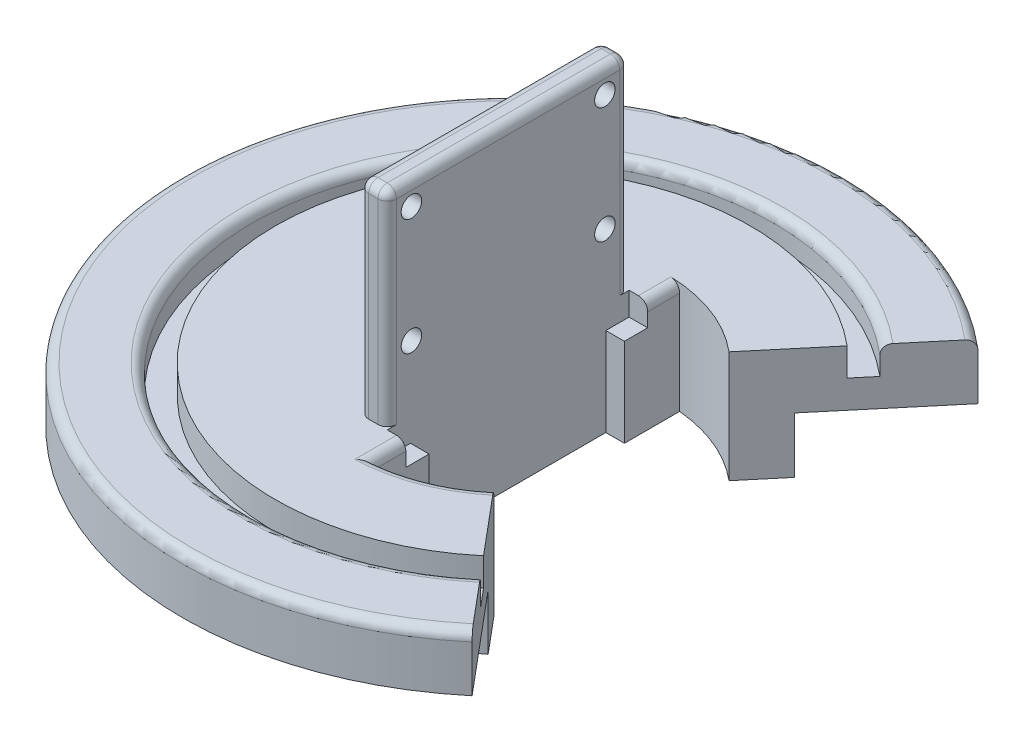
from build123d import *

# Parameters (mm, degrees)
RESSALTO_EXTRUS_O1_DEPTH = 12
RESSALTO_EXTRUS_O3_DEPTH = 6
ESBO_O4_W                = 3
ESBO_O4_H                = 26
RESSALTO_EXTRUS_O4_DEPTH = 22
ESBO_O6_W                = 2.5
ESBO_O6_H                = 9.5
RESSALTO_EXTRUS_O5_DEPTH = 2
ESBO_O7_R                = 1.1
CORTE_EXTRUS_O1_DEPTH    = 55.490824916
ESBO_O8_R                = 28.014084507
ESBO_O8_R_2              = 25.514084507
CORTE_EXTRUS_O2_DEPTH    = 3
FILETE1_R                = 1


with BuildPart() as part:
    # Esboço1 → Ressalto-extrusão1 (new body)
    with BuildSketch(Plane(origin=(0, 0, 0), x_dir=(1, 0, 0), z_dir=(0, 1, 0))):
        with BuildLine():
            Line((1.5, -16.431676725), (1.5, -13))
            Line((1.5, -13), (-0.5, -13))
            Line((-0.5, -13), (-0.5, 13))
            Line((-0.5, 13), (1.5, 13))
            Line((1.5, 13), (1.5, 16.431676725))
            ThreePointArc((1.5, 16.431676725), (6.342987532, 15.232088142), (10.60599556, 12.639733311))
            Line((10.60599556, 12.639733311), (13.819933608, 16.469955527))
            ThreePointArc((13.819933608, 16.469955527), (-21.5, 0), (13.819933608, -16.469955527))
            Line((13.819933608, -16.469955527), (10.60599556, -12.639733311))
            ThreePointArc((10.60599556, -12.639733311), (6.342987532, -15.232088142), (1.5, -16.431676725))
        make_face()
    extrude(amount=-RESSALTO_EXTRUS_O1_DEPTH)

    # Esboço3 → Ressalto-extrusão3 (add)
    with BuildSketch(Plane(origin=(0, 0, 0), x_dir=(1, 0, 0), z_dir=(0, 1, 0))):
        with BuildLine():
            Line((13.819933608, -16.469955527), (22.818960144, -27.194577731))
            ThreePointArc((22.818960144, -27.194577731), (-35.5, 0), (22.818960144, 27.194577731))
            Line((22.818960144, 27.194577731), (13.819933608, 16.469955527))
            ThreePointArc((13.819933608, 16.469955527), (-21.5, 0), (13.819933608, -16.469955527))
        make_face()
    extrude(amount=-RESSALTO_EXTRUS_O3_DEPTH)

    # Esboço4 → Ressalto-extrusão4 (add)
    with BuildSketch(Plane(origin=(0, 0, 0), x_dir=(1, 0, 0), z_dir=(0, 1, 0))):
        with Locations((-2, 0)):
            Rectangle(ESBO_O4_W, ESBO_O4_H)
    extrude(amount=RESSALTO_EXTRUS_O4_DEPTH)

    # Esboço6 → Ressalto-extrusão5 (add)
    with BuildSketch(Plane(origin=(-0.5, 0, 0), x_dir=(0, 0, -1), z_dir=(1, 0, 0))):
        with Locations((-11.75, -7.25)):
            Rectangle(ESBO_O6_W, ESBO_O6_H)
        with Locations((11.75, -7.25)):
            Rectangle(ESBO_O6_W, ESBO_O6_H)
    extrude(amount=RESSALTO_EXTRUS_O5_DEPTH)

    # Esboço7 → Corte-extrusão1 (cut, through all)
    with BuildSketch(Plane(origin=(-0.5, 0, 0), x_dir=(0, 0, -1), z_dir=(1, 0, 0))):
        with Locations((-10.4, 19.5)):
            Circle(ESBO_O7_R)
        with Locations((10.4, 19.5)):
            Circle(ESBO_O7_R)
        with Locations((10.4, 7)):
            Circle(ESBO_O7_R)
        with Locations((-10.4, 7)):
            Circle(ESBO_O7_R)
    extrude(amount=-CORTE_EXTRUS_O1_DEPTH, mode=Mode.SUBTRACT)

    # Esboço8 → Corte-extrusão2 (cut)
    with BuildSketch(Plane(origin=(0, 0, 0), x_dir=(1, 0, 0), z_dir=(0, 1, 0))):
        Circle(ESBO_O8_R)
        Circle(ESBO_O8_R_2, mode=Mode.SUBTRACT)
    extrude(amount=-CORTE_EXTRUS_O2_DEPTH, mode=Mode.SUBTRACT)

    # Filete1
    # the kernel refuses this fillet: 1 mm, written as the material it takes off along each edge
    with BuildSketch(Plane(origin=(-2.5, 21, 12), x_dir=(0, 0, 1), z_dir=(-1, 0, 0))) as filete1_piece_1_section:
        Polygon((0, 0), (FILETE1_R * 1.02, 0), (FILETE1_R * 1.02, FILETE1_R * 1.02), (0, FILETE1_R * 1.02), align=None)
    filete1_piece_1 = extrude(amount=FILETE1_R * 1.02, mode=Mode.PRIVATE)
    filete1_piece_1 = filete1_piece_1 - Plane(origin=(-2.5, 21, 12), x_dir=(0, -0.7071067811865475, -0.7071067811865475), z_dir=(-1, 0, 0)) * Sphere(FILETE1_R, mode=Mode.PRIVATE)
    add(filete1_piece_1, mode=Mode.SUBTRACT)
    with BuildSketch(Plane(origin=(-1.5, 21, 12), x_dir=(0, 0, 1), z_dir=(0, 1, 0))) as filete1_piece_2_section:
        Polygon((0, 0), (FILETE1_R * 1.02, 0), (FILETE1_R * 1.02, FILETE1_R * 1.02), (0, FILETE1_R * 1.02), align=None)
    filete1_piece_2 = extrude(amount=FILETE1_R * 1.02, mode=Mode.PRIVATE)
    filete1_piece_2 = filete1_piece_2 - Plane(origin=(-1.5, 21, 12), x_dir=(-0.7071067811865476, 0, -0.7071067811865475), z_dir=(0, 1, 0)) * Sphere(FILETE1_R, mode=Mode.PRIVATE)
    add(filete1_piece_2, mode=Mode.SUBTRACT)
    with BuildSketch(Plane(origin=(-1.5, 21, -12), x_dir=(1, 0, 0), z_dir=(0, 1, 0))) as filete1_piece_3_section:
        Polygon((0, 0), (FILETE1_R * 1.02, 0), (FILETE1_R * 1.02, FILETE1_R * 1.02), (0, FILETE1_R * 1.02), align=None)
    filete1_piece_3 = extrude(amount=FILETE1_R * 1.02, mode=Mode.PRIVATE)
    filete1_piece_3 = filete1_piece_3 - Plane(origin=(-1.5, 21, -12), x_dir=(-0.7071067811865475, 0, 0.7071067811865477), z_dir=(0, 1, 0)) * Sphere(FILETE1_R, mode=Mode.PRIVATE)
    add(filete1_piece_3, mode=Mode.SUBTRACT)
    with BuildSketch(Plane(origin=(-2.5, 21, -12), x_dir=(0, 1, 0), z_dir=(-1, 0, 0))) as filete1_piece_4_section:
        Polygon((0, 0), (FILETE1_R * 1.02, 0), (FILETE1_R * 1.02, FILETE1_R * 1.02), (0, FILETE1_R * 1.02), align=None)
    filete1_piece_4 = extrude(amount=FILETE1_R * 1.02, mode=Mode.PRIVATE)
    filete1_piece_4 = filete1_piece_4 - Plane(origin=(-2.5, 21, -12), x_dir=(0, -0.7071067811865475, 0.7071067811865475), z_dir=(-1, 0, 0)) * Sphere(FILETE1_R, mode=Mode.PRIVATE)
    add(filete1_piece_4, mode=Mode.SUBTRACT)
    with BuildSketch(Plane(origin=(1.5, 0, -10.5), x_dir=(-1, 0, 0), z_dir=(0, 0, -1))) as filete1_piece_5_section:
        with BuildLine():
            CenterArc((FILETE1_R, -FILETE1_R), FILETE1_R, 90, 90)
            Line((0, -FILETE1_R), (0, 0))
            Line((0, 0), (FILETE1_R, 0))
        make_face()
    filete1_piece_5 = extrude(amount=8.431676725, mode=Mode.PRIVATE)
    filete1_piece_5 = filete1_piece_5 & Plane(origin=(0, 0, 0), x_dir=(0.09090909090909027, 0, -0.9958591954639385), z_dir=(0, 1, 0)) * Cylinder(16.5, 21, mode=Mode.PRIVATE)
    add(filete1_piece_5, mode=Mode.SUBTRACT)
    with BuildSketch(Plane(origin=(0, 0, 0), x_dir=(0.7087130276081794, 0, -0.7054968777382703), z_dir=(0.7054968777382703, 0, 0.7087130276081794))) as filete1_piece_6:
        with BuildLine():
            CenterArc((28.014084507 + FILETE1_R, -FILETE1_R), FILETE1_R, 90, 90)
            Line((28.014084507, -FILETE1_R), (28.014084507, 0))
            Line((28.014084507, 0), (28.014084507 + FILETE1_R, 0))
        make_face()
    revolve(axis=Axis((0, 0, 0), (0, 1, 0)), revolution_arc=270.260599923, mode=Mode.SUBTRACT)
    with BuildSketch(Plane(origin=(1.5, 0, 18.931676725), x_dir=(-1, 0, 0), z_dir=(0, 0, -1))) as filete1_piece_7_section:
        with BuildLine():
            CenterArc((FILETE1_R, -FILETE1_R), FILETE1_R, 90, 90)
            Line((0, -FILETE1_R), (0, 0))
            Line((0, 0), (FILETE1_R, 0))
        make_face()
    filete1_piece_7 = extrude(amount=8.431676725, mode=Mode.PRIVATE)
    filete1_piece_7 = filete1_piece_7 & Plane(origin=(0, 0, 0), x_dir=(0.6427876096865377, 0, 0.7660444431189795), z_dir=(0, 1, 0)) * Cylinder(16.5, 21, mode=Mode.PRIVATE)
    add(filete1_piece_7, mode=Mode.SUBTRACT)
    with BuildSketch(Plane(origin=(0, 0, 0), x_dir=(0.7510532880617147, 0, 0.6602415910041466), z_dir=(0.6602415910041466, 0, -0.7510532880617147))) as filete1_piece_8_section:
        with BuildLine():
            CenterArc((16.5 + FILETE1_R, FILETE1_R), FILETE1_R, 180, 90)
            Line((16.5, FILETE1_R), (16.5, 0))
            Line((16.5, 0), (16.5 + FILETE1_R, 0))
        make_face()
    filete1_piece_8 = revolve(axis=Axis((0, 0, 0), (0, -1, 0)), revolution_arc=52.147490436, mode=Mode.PRIVATE)
    filete1_piece_8 = split(filete1_piece_8, bisect_by=Plane(origin=(1.5, 0, 0), z_dir=(1, 0, 0)), keep=Keep.TOP, mode=Mode.PRIVATE)
    add(filete1_piece_8, mode=Mode.SUBTRACT)
    with BuildSketch(Plane(origin=(0, 0, 0), x_dir=(0.6952666452885745, 0, 0.7187518987447418), z_dir=(0.7187518987447418, 0, -0.6952666452885745))) as filete1_piece_9:
        with BuildLine():
            CenterArc((35.5 - FILETE1_R, FILETE1_R), FILETE1_R, 270, 90)
            Line((35.5 - FILETE1_R, 0), (35.5, 0))
            Line((35.5, 0), (35.5, FILETE1_R))
        make_face()
    revolve(axis=Axis((0, 0, 0), (0, -1, 0)), revolution_arc=268.096938404, mode=Mode.SUBTRACT)
    with BuildSketch(Plane(origin=(-3.5, 0, 13), x_dir=(0, 0, -1), z_dir=(0, 1, 0)), Plane(origin=(-0.5, 0, 13), x_dir=(-1, 0, 0), z_dir=(0, 1, 0)), Plane(origin=(-3.5, 0, -13), x_dir=(1, 0, 0), z_dir=(0, 1, 0))) as filete1_piece_10:
        with BuildLine():
            CenterArc((FILETE1_R, -FILETE1_R), FILETE1_R, 90, 90)
            Line((0, -FILETE1_R), (0, 0))
            Line((0, 0), (FILETE1_R, 0))
        make_face()
    extrude(amount=21, mode=Mode.SUBTRACT)
    with BuildSketch(Plane(origin=(-0.5, 0, -13), x_dir=(-1, 0, 0), z_dir=(0, 1, 0))) as filete1_piece_11:
        with BuildLine():
            CenterArc((FILETE1_R, FILETE1_R), FILETE1_R, 180, 90)
            Line((0, FILETE1_R), (0, 0))
            Line((0, 0), (FILETE1_R, 0))
        make_face()
    extrude(amount=21, mode=Mode.SUBTRACT)
    with BuildSketch(Plane(origin=(-2.5, 22, 13), x_dir=(0, -1, 0), z_dir=(1, 0, 0)), Plane(origin=(-1.5, 22, -13), x_dir=(0, -1, 0), z_dir=(-1, 0, 0))) as filete1_piece_12:
        with BuildLine():
            CenterArc((FILETE1_R, FILETE1_R), FILETE1_R, 180, 90)
            Line((0, FILETE1_R), (0, 0))
            Line((0, 0), (FILETE1_R, 0))
        make_face()
    extrude(amount=1, mode=Mode.SUBTRACT)
    with BuildSketch(Plane(origin=(-0.5, 22, 12), x_dir=(0, -1, 0), z_dir=(0, 0, -1)), Plane(origin=(-3.5, 22, -12), x_dir=(0, -1, 0), z_dir=(0, 0, 1))) as filete1_piece_13:
        with BuildLine():
            CenterArc((FILETE1_R, FILETE1_R), FILETE1_R, 180, 90)
            Line((0, FILETE1_R), (0, 0))
            Line((0, 0), (FILETE1_R, 0))
        make_face()
    extrude(amount=24, mode=Mode.SUBTRACT)
    with BuildSketch(Plane(origin=(1.5, 0, 18.931676725), x_dir=(-1, 0, 0), z_dir=(0, 0, -1))) as filete1_piece_14a_section:
        with BuildLine():
            CenterArc((FILETE1_R, -FILETE1_R), FILETE1_R, 90, 90)
            Line((0, -FILETE1_R), (0, 0))
            Line((0, 0), (FILETE1_R, 0))
        make_face()
    filete1_piece_14a = extrude(amount=5.931676725, mode=Mode.PRIVATE)
    filete1_piece_14a = filete1_piece_14a - Plane(origin=(0, 0, 0), x_dir=(0.6427876096865377, 0, 0.7660444431189795), z_dir=(0, 1, 0)) * Cylinder(16.5, 16, mode=Mode.PRIVATE)
    with BuildSketch(Plane(origin=(0, 0, 0), x_dir=(0.6427876096865377, 0, 0.7660444431189793), z_dir=(0.7660444431189793, 0, -0.6427876096865377))) as filete1_piece_14b_section:
        with BuildLine():
            CenterArc((16.5 + FILETE1_R, FILETE1_R), FILETE1_R, 180, 90)
            Line((16.5, FILETE1_R), (16.5, 0))
            Line((16.5, 0), (16.5 + FILETE1_R, 0))
        make_face()
    filete1_piece_14b = revolve(axis=Axis((0, 0, 0), (0, -1, 0)), revolution_arc=43.465790933, mode=Mode.PRIVATE)
    filete1_piece_14b = split(filete1_piece_14b, bisect_by=Plane(origin=(1.5, 0, 0), z_dir=(-1, 0, 0)), keep=Keep.TOP, mode=Mode.PRIVATE)
    filete1_piece_14 = filete1_piece_14a & filete1_piece_14b
    add(filete1_piece_14, mode=Mode.SUBTRACT)


solid = part.part
